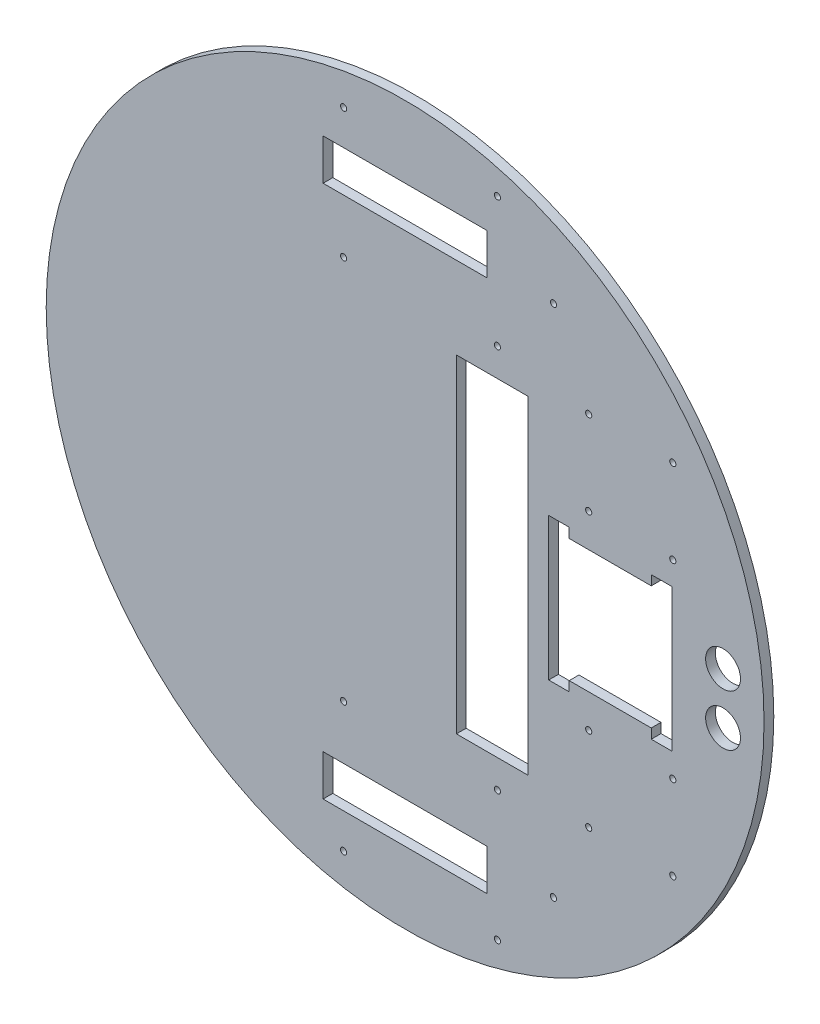
from build123d import *

# Parameters (mm, degrees)
SKETCH1_R           = 175
BOSS_EXTRUDE1_DEPTH = 4.75
SKETCH2_W           = 80
SKETCH2_H           = 20
SKETCH2_W_2         = 60
SKETCH2_H_2         = 60
CUT_EXTRUDE1_DEPTH  = 4.75
SKETCH3_W           = 10
SKETCH3_H           = 4.75
CUT_EXTRUDE2_DEPTH  = 4.75
SKETCH4_R           = 1.5
CUT_EXTRUDE3_DEPTH  = 248.532952352
SKETCH5_R           = 1.5
CUT_EXTRUDE4_DEPTH  = 248.532952352
SKETCH6_R           = 8.5
CUT_EXTRUDE5_DEPTH  = 4.75
CAVITY1_OUTLINE_R   = 1.5
CAVITY1_DEPTH       = 4.75
SKETCH7_W           = 35
SKETCH7_H           = 160
CUT_EXTRUDE6_DEPTH  = 248.532952352


# Read off the part's stored shape, not the designer's step: Cavity1
with BuildPart() as part:
    # Sketch1 → Boss-Extrude1 (new body)
    with BuildSketch(Plane.XY):
        Circle(SKETCH1_R)
    extrude(amount=BOSS_EXTRUDE1_DEPTH)

    # Sketch2 → Cut-Extrude1 (cut)
    with BuildSketch(Plane(origin=(0, 0, 0), x_dir=(-1, 0, 0), z_dir=(0, 0, -1))):
        with Locations((0, 130)):
            Rectangle(SKETCH2_W, SKETCH2_H)
        with Locations((0, -130)):
            Rectangle(SKETCH2_W, SKETCH2_H)
        with Locations((-100, 0)):
            Rectangle(SKETCH2_W_2, SKETCH2_H_2)
    extrude(amount=-CUT_EXTRUDE1_DEPTH, mode=Mode.SUBTRACT)

    # Sketch3 → Cut-Extrude2 (cut)
    with BuildSketch(Plane.XY.offset(4.75)):
        with Locations((75, 32.375)):
            Rectangle(SKETCH3_W, SKETCH3_H)
        with Locations((125, 32.375)):
            Rectangle(SKETCH3_W, SKETCH3_H)
        with Locations((75, -32.375)):
            Rectangle(SKETCH3_W, SKETCH3_H)
        with Locations((125, -32.375)):
            Rectangle(SKETCH3_W, SKETCH3_H)
    extrude(amount=-CUT_EXTRUDE2_DEPTH, mode=Mode.SUBTRACT)

    # Sketch4 → Cut-Extrude3 (cut, through all)
    with BuildSketch(Plane.XY.offset(4.75)):
        with Locations((-30, -157)):
            Circle(SKETCH4_R)
        with Locations((45, -157)):
            Circle(SKETCH4_R)
        with Locations(Location((-30, 157, 0), (0, 0, 180))):
            Circle(SKETCH4_R)
        with Locations(Location((45, 157, 0), (0, 0, 180))):
            Circle(SKETCH4_R)
        with Locations(Location((45, -93.75, 0), (0, 0, 180))):
            Circle(SKETCH4_R)
        with Locations(Location((-30, -93.75, 0), (0, 0, 180))):
            Circle(SKETCH4_R)
        with Locations((45, 93.75)):
            Circle(SKETCH4_R)
        with Locations((-30, 93.75)):
            Circle(SKETCH4_R)
    extrude(amount=-CUT_EXTRUDE3_DEPTH, mode=Mode.SUBTRACT)

    # Sketch5 → Cut-Extrude4 (cut, through all)
    with BuildSketch(Plane.XY.offset(4.75)):
        with Locations((89.5, 87.25)):
            Circle(SKETCH5_R)
        with Locations((130.5, 87.25)):
            Circle(SKETCH5_R)
        with Locations((130.5, 46.25)):
            Circle(SKETCH5_R)
        with Locations((89.5, 46.25)):
            Circle(SKETCH5_R)
        with Locations(Location((89.5, -87.25, 0), (0, 0, 180))):
            Circle(SKETCH5_R)
        with Locations(Location((130.5, -87.25, 0), (0, 0, 180))):
            Circle(SKETCH5_R)
        with Locations(Location((130.5, -46.25, 0), (0, 0, 180))):
            Circle(SKETCH5_R)
        with Locations(Location((89.5, -46.25, 0), (0, 0, 180))):
            Circle(SKETCH5_R)
    extrude(amount=-CUT_EXTRUDE4_DEPTH, mode=Mode.SUBTRACT)

    # Sketch6 → Cut-Extrude5 (cut)
    with BuildSketch(Plane.XY.offset(4.75)):
        with Locations((155, 12.5)):
            Circle(SKETCH6_R)
        with Locations((155, -12.5)):
            Circle(SKETCH6_R)
    extrude(amount=-CUT_EXTRUDE5_DEPTH, mode=Mode.SUBTRACT)

    # Cavity1 outline → Cavity1 (cut)
    with BuildSketch(Plane.XY):
        with Locations((72.337603572, -125.375)):
            Circle(CAVITY1_OUTLINE_R)
        with Locations((72.337603572, 125.375)):
            Circle(CAVITY1_OUTLINE_R)
    extrude(amount=CAVITY1_DEPTH, mode=Mode.SUBTRACT)

    # Sketch7 → Cut-Extrude6 (cut, through all)
    with BuildSketch(Plane.XY.offset(4.75)):
        with Locations((42.5, 0)):
            Rectangle(SKETCH7_W, SKETCH7_H)
    extrude(amount=-CUT_EXTRUDE6_DEPTH, mode=Mode.SUBTRACT)


solid = part.part
